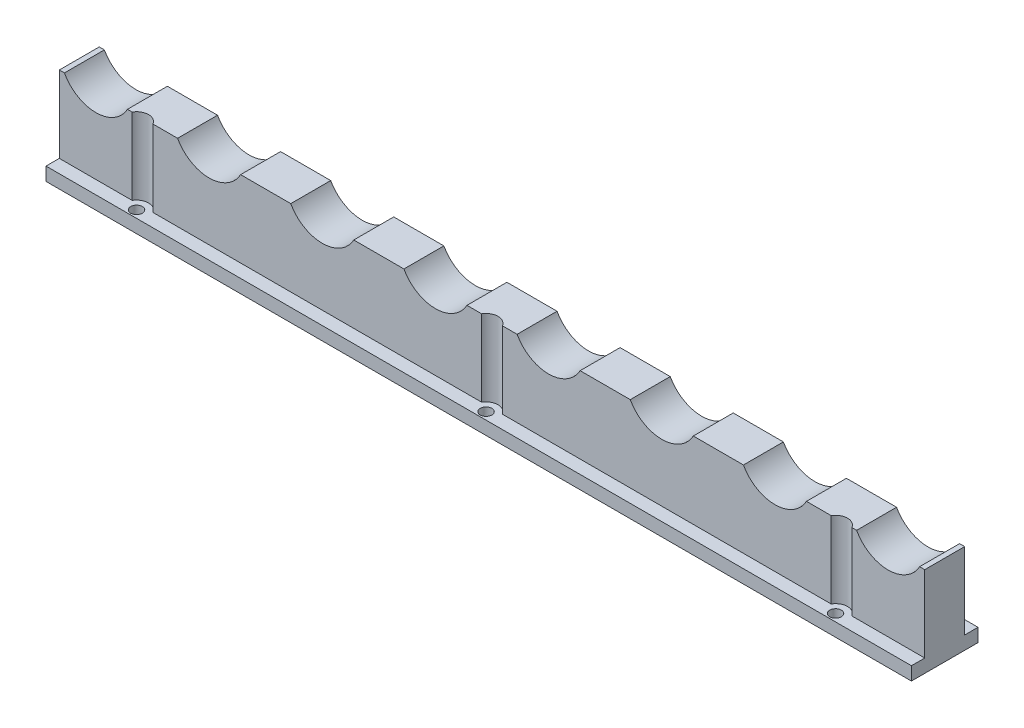
from build123d import *

# Parameters (mm, degrees)
SKETCH1_W                                            = 1300
SKETCH1_H                                            = 135
BOSS_EXTRUDE1_DEPTH                                  = 50
SKETCH14_W                                           = 1300
SKETCH14_H                                           = 115
CUT_EXTRUDE1_DEPTH                                   = 20
CBORE_FOR_M16_HEX_SOCKET_HEAD_CAP_SCREW1_D           = 17.5
CBORE_FOR_M16_HEX_SOCKET_HEAD_CAP_SCREW1_CBORE_D     = 36
CBORE_FOR_M16_HEX_SOCKET_HEAD_CAP_SCREW1_CBORE_DEPTH = 115
CUT_EXTRUDE_KIINNITYSPINTA_DEPTH                     = 672.360558865
LPATTERN_KIINNITYSPINTA_COUNT                        = 8
LPATTERN_KIINNITYSPINTA_PITCH                        = 170
LPATTERN5_COUNT                                      = 3
LPATTERN5_PITCH                                      = 525


with BuildPart() as part:
    # Sketch1 → Boss-Extrude1 (new, symmetric)
    with BuildSketch(Plane.XY):
        with Locations((0, 67.5)):
            Rectangle(SKETCH1_W, SKETCH1_H)
    extrude(amount=BOSS_EXTRUDE1_DEPTH, both=True)

    # Sketch14 → Cut-Extrude1 (cut)
    with BuildSketch(Plane.XY.offset(50)):
        with Locations((0, 77.5)):
            Rectangle(SKETCH14_W, SKETCH14_H)
    cut_extrude1 = extrude(amount=-CUT_EXTRUDE1_DEPTH, mode=Mode.SUBTRACT)

    # Mirror1: Cut-Extrude1 across plane
    add(cut_extrude1.mirror(Plane.XY), mode=Mode.SUBTRACT)

    # CBORE for M16 Hex Socket Head Cap Screw1 (through all)
    with Locations(Plane(origin=(0, 135, 0), x_dir=(1, 0, 0), z_dir=(0, 1, 0))):
        with Locations((-525, -39)):
            cbore_for_m16_hex_socket_head_cap_screw1 = CounterBoreHole(CBORE_FOR_M16_HEX_SOCKET_HEAD_CAP_SCREW1_D / 2, CBORE_FOR_M16_HEX_SOCKET_HEAD_CAP_SCREW1_CBORE_D / 2, CBORE_FOR_M16_HEX_SOCKET_HEAD_CAP_SCREW1_CBORE_DEPTH)

    # Sketch2 → Cut-Extrude_KiinnitysPinta (cut, through all)
    with BuildSketch(Plane.XY.offset(50)):
        with BuildLine():
            Line((-547.671361735, 135), (-642.328638265, 135))
            ThreePointArc((-642.328638265, 135), (-595, 107), (-547.671361735, 135))
        make_face()
    cut_extrude_kiinnityspinta = extrude(amount=-CUT_EXTRUDE_KIINNITYSPINTA_DEPTH, mode=Mode.SUBTRACT)

    # LPattern_kiinnitysPinta: Cut-Extrude_KiinnitysPinta ×8
    with Locations(*[(i * LPATTERN_KIINNITYSPINTA_PITCH, 0, 0) for i in range(1, LPATTERN_KIINNITYSPINTA_COUNT)]):
        add(cut_extrude_kiinnityspinta, mode=Mode.SUBTRACT)

    # LPattern5: CBORE for M16 Hex Socket Head Cap Screw1 ×3
    with Locations(*[(i * LPATTERN5_PITCH, 0, 0) for i in range(1, LPATTERN5_COUNT)]):
        add(cbore_for_m16_hex_socket_head_cap_screw1, mode=Mode.SUBTRACT)

    # Mirror_kiilaura: Cut-Extrude_KiinnitysPinta across plane
    add(cut_extrude_kiinnityspinta.mirror(Plane(origin=(0, 0, 0), x_dir=(0, 0, 1), z_dir=(1, 0, 0))), mode=Mode.SUBTRACT)


solid = part.part
